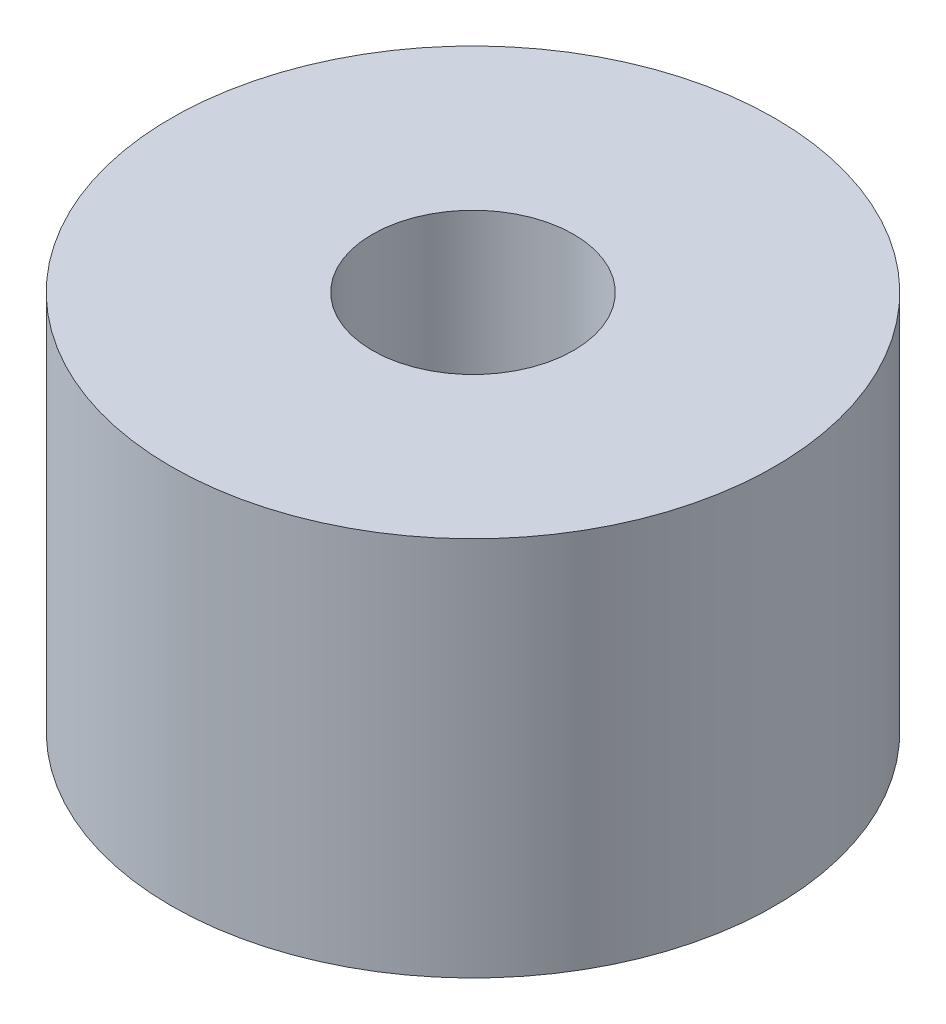
from build123d import *

# Parameters (mm, degrees)
CROQUIS1_R              = 4.76
CROQUIS1_R_2            = 1.5875
SALIENTE_EXTRUIR1_DEPTH = 6


with BuildPart() as part:
    # Croquis1 → Saliente-Extruir1 (new body)
    with BuildSketch(Plane(origin=(0, 0, 0), x_dir=(1, 0, 0), z_dir=(0, 1, 0))):
        Circle(CROQUIS1_R)
        Circle(CROQUIS1_R_2, mode=Mode.SUBTRACT)
    extrude(amount=SALIENTE_EXTRUIR1_DEPTH)


solid = part.part
